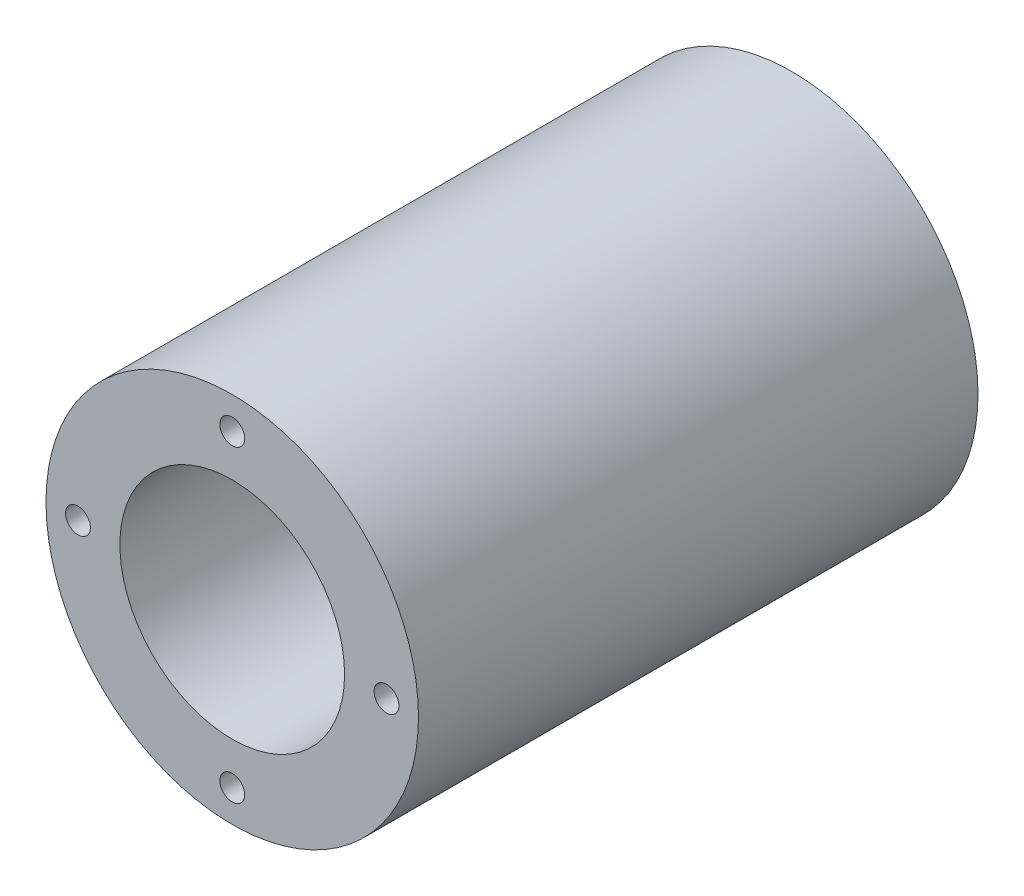
from build123d import *

# Parameters (mm, degrees)
BACKFACEPATTERN_COUNT  = 6
FRONTFACEPATTERN_COUNT = 4
SKETCH7_R              = 26.9875
SKETCH7_R_2            = 25.4
CUT_EXTRUDE1_DEPTH     = 0.5


with BuildPart() as part:
    # Sketch1 → Revolve1 (revolve)
    with BuildSketch(Plane(origin=(0, 0, 0), x_dir=(0, 0, -1), z_dir=(1, 0, 0))):
        Polygon((-23.625, 22.6187), (-23.625, 37.5), (-136.284000101, 37.49999993), (-136.284000101, 22.6187), align=None)
    revolve(axis=Axis((0, 0, 136.284000101), (0, 0, -1)))

    # Sketch9 → M6x1.0 Tapped Hole3 (revolve, cut)
    with BuildSketch(Plane(origin=(0, 31.05935, 23.625), x_dir=(0, 1, 0), z_dir=(1, 0, 0))):
        Polygon((0, 0), (0, 16.502151548), (2.5, 15), (2.5, 0), align=None)
    m6x1_0_tapped_hole3 = revolve(axis=Axis((0, 31.05935, 17.275), (0, 0, 1)), mode=Mode.SUBTRACT)

    # BackFacePattern: M6x1.0 Tapped Hole3 ×6 about axis
    backfacepattern_axis = Axis((0, 0, 1000), (0, 0, -1))
    for i in range(1, BACKFACEPATTERN_COUNT):
        add(m6x1_0_tapped_hole3.rotate(backfacepattern_axis, i * 360 / BACKFACEPATTERN_COUNT), mode=Mode.SUBTRACT)

    # Sketch6 → M6x1.0 Tapped Hole2 (revolve, cut)
    with BuildSketch(Plane(origin=(0, 31.05935, 136.284000101), x_dir=(0, -1, 0), z_dir=(1, 0, 0))):
        Polygon((0, 0), (0, 16.502151548), (2.5, 15), (2.5, 0), align=None)
    m6x1_0_tapped_hole2 = revolve(axis=Axis((0, 31.05935, 142.634000101), (0, 0, -1)), mode=Mode.SUBTRACT)

    # FrontFacePattern: M6x1.0 Tapped Hole2 ×4 about axis
    frontfacepattern_axis = Axis((0, 0, 1000), (0, 0, -1))
    for i in range(1, FRONTFACEPATTERN_COUNT):
        add(m6x1_0_tapped_hole2.rotate(frontfacepattern_axis, i * 360 / FRONTFACEPATTERN_COUNT), mode=Mode.SUBTRACT)

    # Sketch7 → Cut-Extrude1 (cut)
    with BuildSketch(Plane(origin=(0, 0, 23.625), x_dir=(-1, 0, 0), z_dir=(0, 0, -1))):
        Circle(SKETCH7_R)
        Circle(SKETCH7_R_2, mode=Mode.SUBTRACT)
    extrude(amount=-CUT_EXTRUDE1_DEPTH, mode=Mode.SUBTRACT)


solid = part.part
